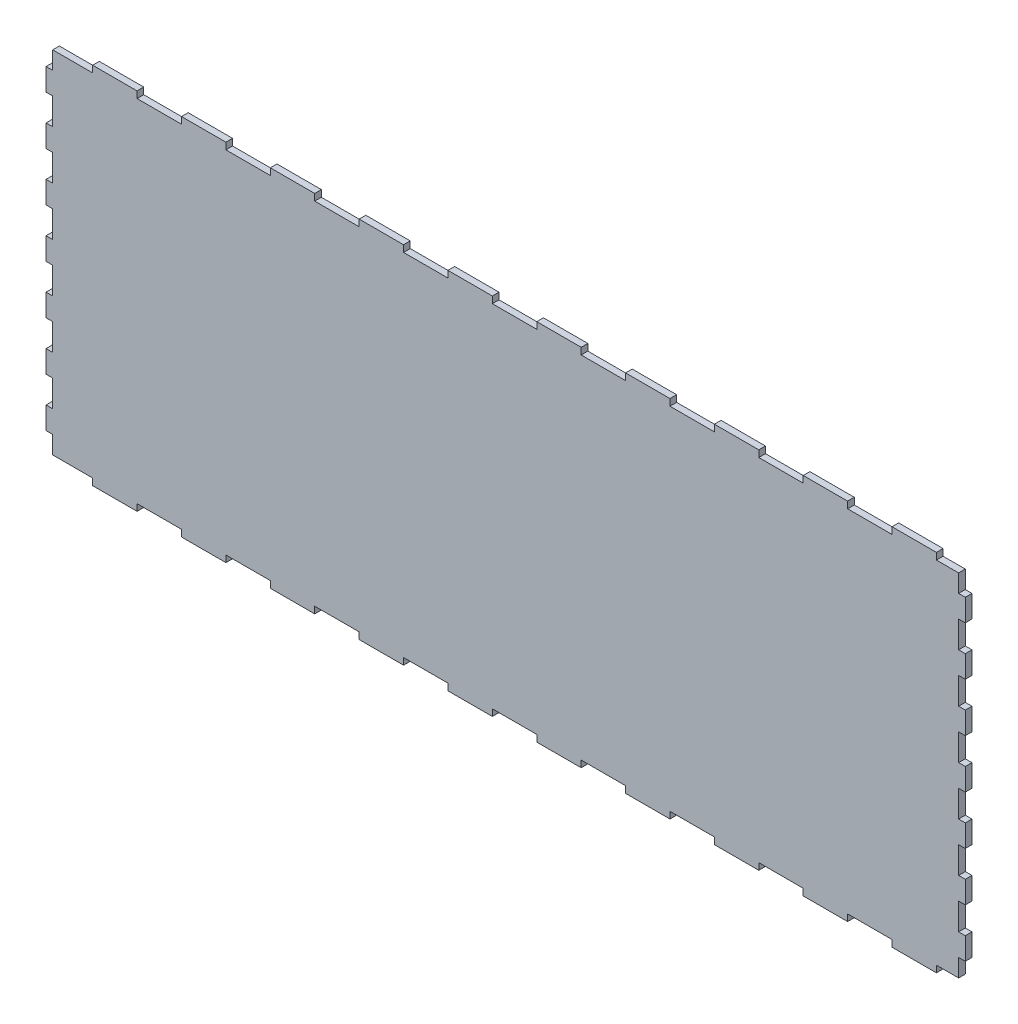
from build123d import *

# Parameters (mm, degrees)
SKETCH1_W           = 414
SKETCH1_H           = 164
BOSS_EXTRUDE1_DEPTH = 3
SKETCH2_W           = 3
SKETCH2_H           = 11
SKETCH2_H_2         = 12
CUT_EXTRUDE1_DEPTH  = 3
CUT_EXTRUDE2_DEPTH  = 3


with BuildPart() as part:
    # Sketch1 → Boss-Extrude1 (new body)
    with BuildSketch(Plane.XY.offset(152)):
        Rectangle(SKETCH1_W, SKETCH1_H)
    extrude(amount=BOSS_EXTRUDE1_DEPTH)

    # Sketch2 → Cut-Extrude1 (cut)
    with BuildSketch(Plane.ZY.offset(207)):
        with Locations((153.5, -76.5)):
            Rectangle(SKETCH2_W, SKETCH2_H)
        with Locations((153.5, -55)):
            Rectangle(SKETCH2_W, SKETCH2_H_2)
        with Locations((153.5, -33)):
            Rectangle(SKETCH2_W, SKETCH2_H_2)
        with Locations((153.5, -11)):
            Rectangle(SKETCH2_W, SKETCH2_H_2)
        with Locations((153.5, 11)):
            Rectangle(SKETCH2_W, SKETCH2_H_2)
        with Locations((153.5, 33)):
            Rectangle(SKETCH2_W, SKETCH2_H_2)
        with Locations((153.5, 55)):
            Rectangle(SKETCH2_W, SKETCH2_H_2)
        with Locations((153.5, 76.5)):
            Rectangle(SKETCH2_W, SKETCH2_H)
    cut_extrude1 = extrude(amount=-CUT_EXTRUDE1_DEPTH, mode=Mode.SUBTRACT)

    # Mirror1: Cut-Extrude1 across plane
    add(cut_extrude1.mirror(Plane(origin=(0, 0, 0), x_dir=(0, 0, 1), z_dir=(1, 0, 0))), mode=Mode.SUBTRACT)

    # Sketch3 → Cut-Extrude2 (cut)
    with BuildSketch(Plane(origin=(0, 82, 0), x_dir=(1, 0, 0), z_dir=(0, 1, 0))):
        Polygon((174, -152), (194, -152), (194, -155), (204, -155), (204, -145), (207, -145), (207, -133), (204, -133), (204, -123), (207, -123), (207, -111), (204, -111), (204, -101), (207, -101), (207, -89), (204, -89), (204, -79), (207, -79), (207, -67), (204, -67), (204, -57), (207, -57), (207, -45), (204, -45), (204, -35), (207, -35), (207, -23), (204, -23), (204, -16), (-204, -16), (-204, -23), (-207, -23), (-207, -35), (-204, -35), (-204, -45), (-207, -45), (-207, -57), (-204, -57), (-204, -67), (-207, -67), (-207, -79), (-204, -79), (-204, -89), (-207, -89), (-207, -101), (-204, -101), (-204, -111), (-207, -111), (-207, -123), (-204, -123), (-204, -133), (-207, -133), (-207, -145), (-204, -145), (-204, -155), (-186, -155), (-186, -152), (-166, -152), (-166, -155), (-146, -155), (-146, -152), (-126, -152), (-126, -155), (-106, -155), (-106, -152), (-86, -152), (-86, -155), (-66, -155), (-66, -152), (-46, -152), (-46, -155), (-26, -155), (-26, -152), (-6, -152), (-6, -155), (14, -155), (14, -152), (34, -152), (34, -155), (54, -155), (54, -152), (74, -152), (74, -155), (94, -155), (94, -152), (114, -152), (114, -155), (134, -155), (134, -152), (154, -152), (154, -155), (174, -155), align=None)
    cut_extrude2 = extrude(amount=-CUT_EXTRUDE2_DEPTH, mode=Mode.SUBTRACT)

    # Mirror2: Cut-Extrude2 across plane
    add(cut_extrude2.mirror(Plane.ZX), mode=Mode.SUBTRACT)


solid = part.part
